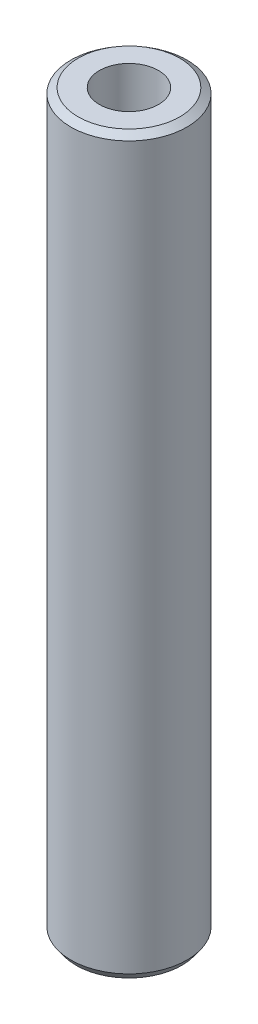
from build123d import *
from OCP.BRepFilletAPI import BRepFilletAPI_MakeChamfer

# Parameters (mm, degrees)
SKETCH1_R           = 47.5
BOSS_EXTRUDE1_DEPTH = 600
SKETCH2_R           = 24.152042802
CUT_EXTRUDE1_DEPTH  = 604.748706003
CHAMFER1_SIZE       = 4.263577452
CHAMFER1_SIZE2      = 5.925190381


with BuildPart() as part:
    # Sketch1 → Boss-Extrude1 (new body)
    with BuildSketch(Plane(origin=(0, 0, 0), x_dir=(1, 0, 0), z_dir=(0, 1, 0))):
        Circle(SKETCH1_R)
    extrude(amount=BOSS_EXTRUDE1_DEPTH)

    # Sketch2 → Cut-Extrude1 (cut, through all)
    with BuildSketch(Plane(origin=(0, 0, 0), x_dir=(1, 0, 0), z_dir=(0, 1, 0))):
        Circle(SKETCH2_R)
    extrude(amount=CUT_EXTRUDE1_DEPTH, mode=Mode.SUBTRACT)

    # Chamfer1: one chamfer whose edges measure the first distance from different faces: ONE call of the kernel's chamfer builder (chamfer() names one face for all edges)
    chamfer1_edges_1 = [part.edges().sort_by_distance(p)[0] for p in [
        (-47.5, 600, 0),
    ]]
    chamfer1_side_1 = [part.faces().sort_by_distance(p)[0] for p in [
        (-47.5, 300, 0),
    ]]
    chamfer1_edges_2 = [part.edges().sort_by_distance(p)[0] for p in [
        (-47.5, 0, 0),
    ]]
    chamfer1_side_2 = [part.faces().sort_by_distance(p)[0] for p in [
        (-46.156497116, 0, 0),
    ]]
    chamfer1 = BRepFilletAPI_MakeChamfer(part.part.solid().wrapped)
    for e in chamfer1_edges_1:
        chamfer1.Add(CHAMFER1_SIZE, CHAMFER1_SIZE2, e.wrapped, chamfer1_side_1[0].wrapped)  # the first distance lies on this face
    for e in chamfer1_edges_2:
        chamfer1.Add(CHAMFER1_SIZE, CHAMFER1_SIZE2, e.wrapped, chamfer1_side_2[0].wrapped)  # the first distance lies on this face
    add(Compound.cast(chamfer1.Shape()), mode=Mode.REPLACE)


solid = part.part
